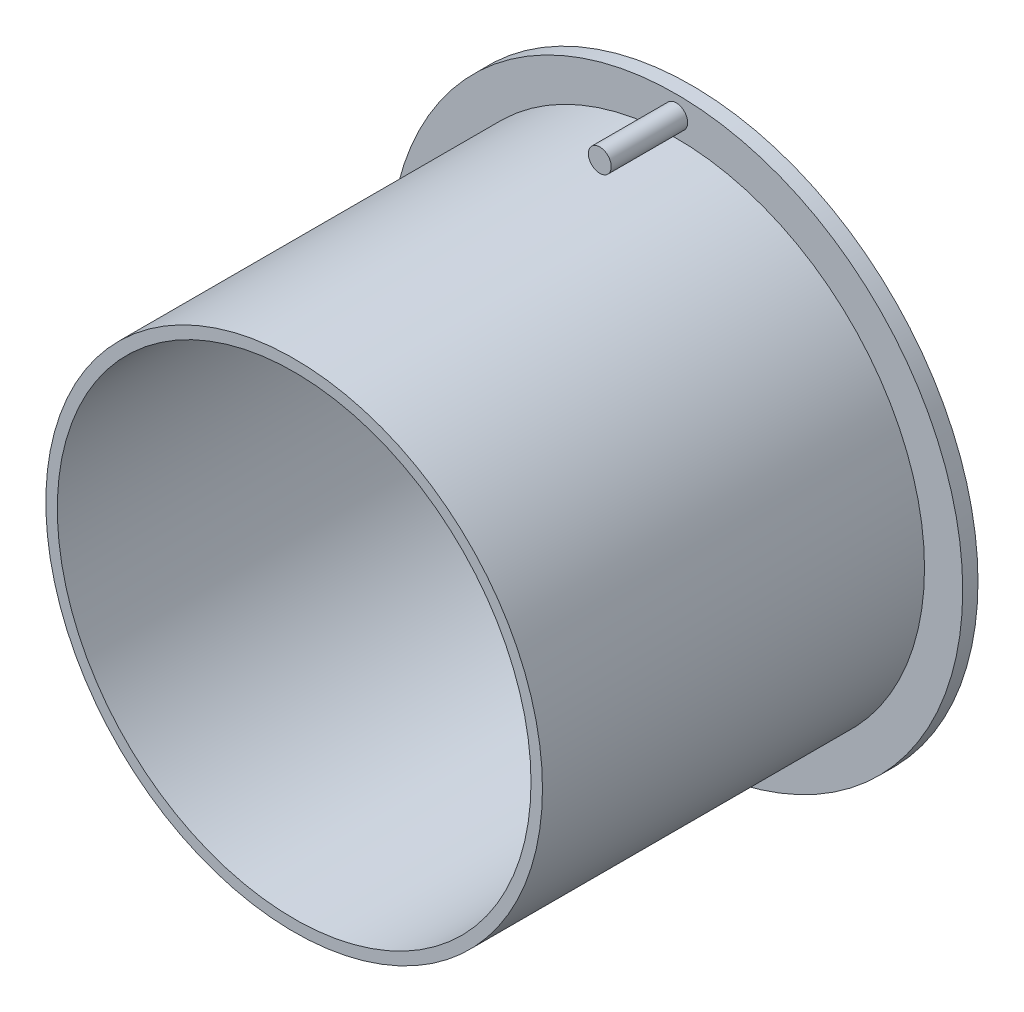
from build123d import *

# Parameters (mm, degrees)
SKETCH1_R           = 37.5
BOSS_EXTRUDE1_DEPTH = 2
SKETCH2_R           = 32.5
SKETCH2_R_2         = 31
BOSS_EXTRUDE2_DEPTH = 55
SKETCH8_R           = 1.5
BOSS_EXTRUDE3_DEPTH = 10
CUT_EXTRUDE1_START  = -5
SKETCH9_R           = 32.5
SKETCH9_R_2         = 31
CUT_EXTRUDE1_DEPTH  = 5


with BuildPart() as part:
    # Sketch1 → Boss-Extrude1 (new body)
    with BuildSketch(Plane.XY):
        Circle(SKETCH1_R)
    extrude(amount=-BOSS_EXTRUDE1_DEPTH)

    # Sketch2 → Boss-Extrude2 (add)
    with BuildSketch(Plane.XY):
        Circle(SKETCH2_R)
        Circle(SKETCH2_R_2, mode=Mode.SUBTRACT)
    extrude(amount=BOSS_EXTRUDE2_DEPTH)

    # Sketch8 → Boss-Extrude3 (add)
    with BuildSketch(Plane.XY):
        with Locations((0, 35)):
            Circle(SKETCH8_R)
        with Locations((0, -35)):
            Circle(SKETCH8_R)
    extrude(amount=BOSS_EXTRUDE3_DEPTH)

    # Sketch9 → Cut-Extrude1 (cut)
    with BuildSketch(Plane.XY.offset(55).offset(CUT_EXTRUDE1_START)):
        Circle(SKETCH9_R)
        Circle(SKETCH9_R_2, mode=Mode.SUBTRACT)
    extrude(amount=CUT_EXTRUDE1_DEPTH, mode=Mode.SUBTRACT)


solid = part.part
